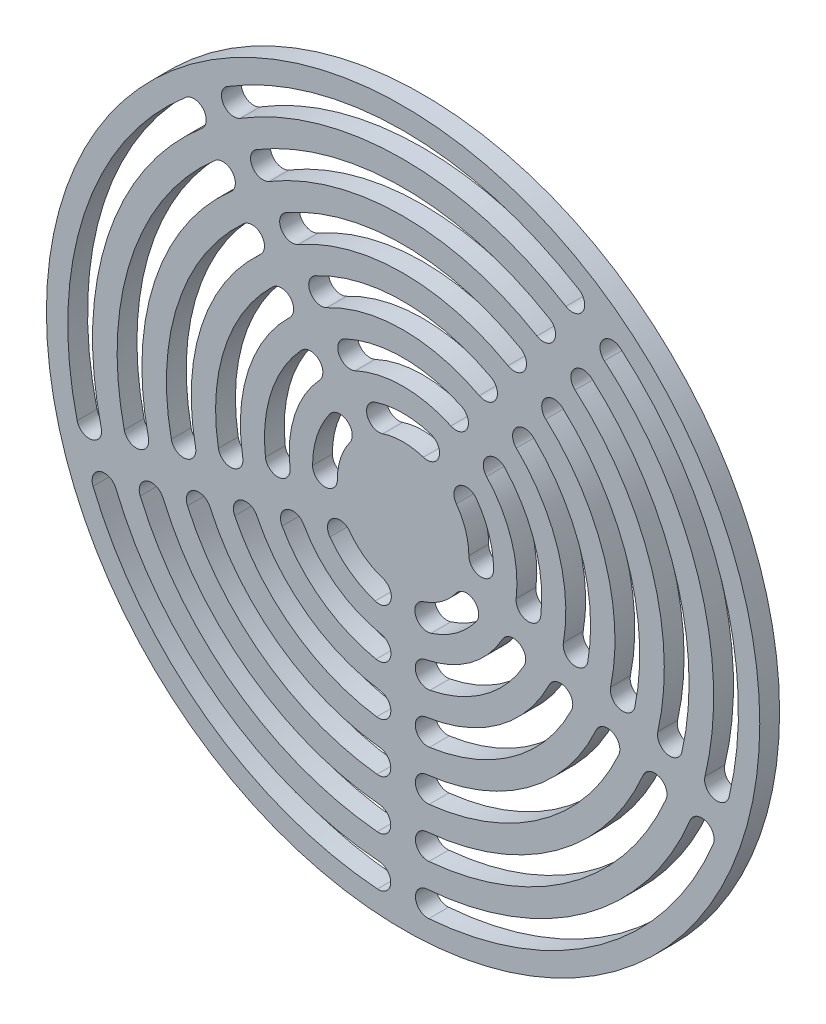
from build123d import *

# Parameters (mm, degrees)
EXTRUDE_1_DEPTH          = 2
CUT_EXTRUDE_1_DEPTH      = 2
PATTERN_START            = -2
PATTERN_LINEAR_1_DEPTH   = 2
PATTERN_CIRCULAR_2_COUNT = 5


# Read off the part's stored shape, not the designer's step: Линейный массив1
with BuildPart() as part:
    # Эскиз1 → Бобышка-Вытянуть1 (new body)
    with BuildSketch(Plane.XY):
        with BuildLine():
            Line((-21.160269083, 29.124611797), (0, 0))
            Line((0, 0), (21.160269083, 29.124611797))
            ThreePointArc((21.160269083, 29.124611797), (0, 36), (-21.160269083, 29.124611797))
        make_face()
    extrude_1 = extrude(amount=-EXTRUDE_1_DEPTH)

    # Эскиз3 → Вырез-Вытянуть1 (cut)
    with BuildSketch(Plane(origin=(0, 0, -2), x_dir=(-1, 0, 0), z_dir=(0, 0, -1))):
        with BuildLine():
            ThreePointArc((2.821419138, 8.689986144), (0, 9.136534635), (-2.821419138, 8.689986144))
            ThreePointArc((-2.821419138, 8.689986144), (-3.624317507, 7.115072112), (-2.049403475, 6.312173743))
            ThreePointArc((-2.049403475, 6.312173743), (0, 6.636534635), (2.049403475, 6.312173743))
            ThreePointArc((2.049403475, 6.312173743), (3.624317507, 7.115072112), (2.821419138, 8.689986144))
        make_face()
    cut_extrude_1 = extrude(amount=-CUT_EXTRUDE_1_DEPTH, mode=Mode.SUBTRACT)

    # Линейный массив1 outline → Линейный массив1 (cut)
    with BuildSketch(Plane.XY.offset(PATTERN_START)):
        with BuildLine():
            ThreePointArc((-5.868267845, 12.702937061), (-6.478815917, 11.043952114), (-4.81983097, 10.433404043))
            ThreePointArc((-4.81983097, 10.433404043), (0, 11.492897394), (4.81983097, 10.433404043))
            ThreePointArc((4.81983097, 10.433404043), (6.478815917, 11.043952114), (5.868267845, 12.702937061))
            ThreePointArc((5.868267845, 12.702937061), (0, 13.992897394), (-5.868267845, 12.702937061))
        make_face()
        with BuildLine():
            ThreePointArc((-14.786044108, 24.78794491), (-15.219207741, 23.074069399), (-13.50533223, 22.640905767))
            ThreePointArc((-13.50533223, 22.640905767), (0, 26.362940135), (13.50533223, 22.640905767))
            ThreePointArc((13.50533223, 22.640905767), (15.219207741, 23.074069399), (14.786044108, 24.78794491))
            ThreePointArc((14.786044108, 24.78794491), (0, 28.862940135), (-14.786044108, 24.78794491))
        make_face()
        with BuildLine():
            ThreePointArc((-17.738574213, 28.824927916), (-18.148018532, 27.10523162), (-16.428322236, 26.695787302))
            ThreePointArc((-16.428322236, 26.695787302), (0, 31.345730668), (16.428322236, 26.695787302))
            ThreePointArc((16.428322236, 26.695787302), (18.148018532, 27.10523162), (17.738574213, 28.824927916))
            ThreePointArc((17.738574213, 28.824927916), (0, 33.845730668), (-17.738574213, 28.824927916))
        make_face()
        with BuildLine():
            ThreePointArc((-8.858865357, 16.724555129), (-9.378370621, 15.034846787), (-7.688662279, 14.515341523))
            ThreePointArc((-7.688662279, 14.515341523), (0, 16.4259145), (7.688662279, 14.515341523))
            ThreePointArc((7.688662279, 14.515341523), (9.378370621, 15.034846787), (8.858865357, 16.724555129))
            ThreePointArc((8.858865357, 16.724555129), (0, 18.9259145), (-8.858865357, 16.724555129))
        make_face()
        with BuildLine():
            ThreePointArc((-11.827697591, 20.75389585), (-12.294790819, 19.04895482), (-10.589849789, 18.581861592))
            ThreePointArc((-10.589849789, 18.581861592), (0, 21.387624898), (10.589849789, 18.581861592))
            ThreePointArc((10.589849789, 18.581861592), (12.294790819, 19.04895482), (11.827697591, 20.75389585))
            ThreePointArc((11.827697591, 20.75389585), (0, 23.887624898), (-11.827697591, 20.75389585))
        make_face()
    pattern_linear_1 = extrude(amount=PATTERN_LINEAR_1_DEPTH, mode=Mode.SUBTRACT)

    # Круговой массив2: Бобышка-Вытянуть1, Вырез-Вытянуть1, Линейный массив1 ×5 about axis
    pattern_circular_2_axis = Axis((0, 0, 0), (0, 0, 1))
    add([extrude_1.rotate(pattern_circular_2_axis, i * 360 / PATTERN_CIRCULAR_2_COUNT) for i in range(1, PATTERN_CIRCULAR_2_COUNT)])
    add([cut_extrude_1.rotate(pattern_circular_2_axis, i * 360 / PATTERN_CIRCULAR_2_COUNT) for i in range(1, PATTERN_CIRCULAR_2_COUNT)], mode=Mode.SUBTRACT)
    add([pattern_linear_1.rotate(pattern_circular_2_axis, i * 360 / PATTERN_CIRCULAR_2_COUNT) for i in range(1, PATTERN_CIRCULAR_2_COUNT)], mode=Mode.SUBTRACT)


solid = part.part
